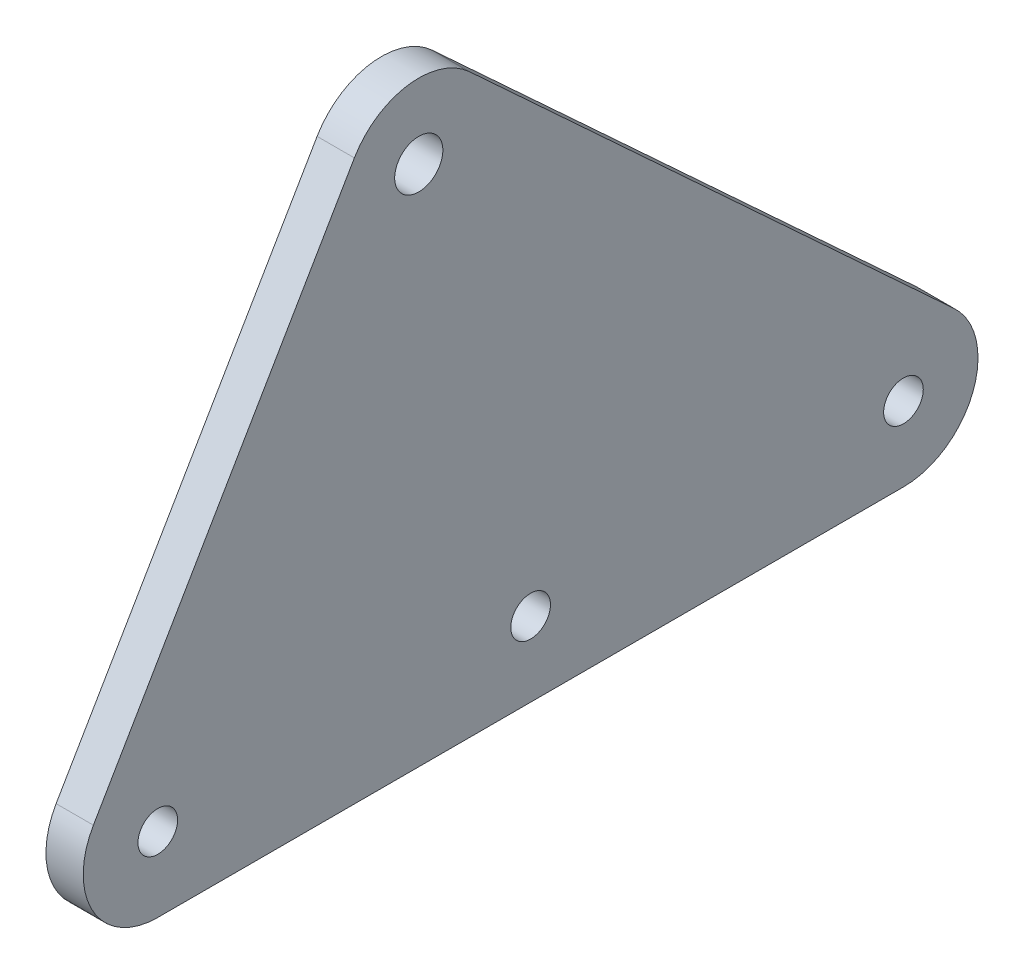
from build123d import *

# Parameters (mm, degrees)
BOSS_EXTRUDE1_DEPTH = 6.35
CUT_EXTRUDE1_REACH  = 132.446
SKETCH2_R           = 3.3782
SKETCH2_R_2         = 4.1021


with BuildPart() as part:
    # Sketch1 → Boss-Extrude1 (new body)
    with BuildSketch(Plane(origin=(0, 0, 0), x_dir=(0, 0, -1), z_dir=(1, 0, 0))):
        with BuildLine():
            Line((-55.419992041, -69.800837976), (-10.969992041, 6.399162024))
            ThreePointArc((-10.969992041, 6.399162024), (-1.880925163, 12.559941104), (8.614157305, 9.332003747))
            Line((8.614157305, 9.332003747), (91.164157305, -66.867996253))
            ThreePointArc((91.164157305, -66.867996253), (94.378069318, -80.824583896), (82.55, -88.9))
            Line((82.55, -88.9), (-44.45, -88.9))
            ThreePointArc((-44.45, -88.9), (-55.462705338, -82.525371226), (-55.419992041, -69.800837976))
        make_face()
    extrude(amount=BOSS_EXTRUDE1_DEPTH)

    # Sketch2 → Cut-Extrude1 (cut, up to next)
    with BuildSketch(Plane(origin=(6.35, 0, 0), x_dir=(0, 0, -1), z_dir=(1, 0, 0)), mode=Mode.PRIVATE) as cut_extrude1_sk1:
        with Locations((-44.45, -76.2)):
            Circle(SKETCH2_R)
    cut_extrude1_tool1 = extrude(cut_extrude1_sk1.sketch, amount=-CUT_EXTRUDE1_REACH, mode=Mode.PRIVATE) & part.part
    # Sketch2 → Cut-Extrude1 (cut, up to next)
    with BuildSketch(Plane(origin=(6.35, 0, 0), x_dir=(0, 0, -1), z_dir=(1, 0, 0)), mode=Mode.PRIVATE) as cut_extrude1_sk2:
        with Locations((19.05, -76.2)):
            Circle(SKETCH2_R)
    cut_extrude1_tool2 = extrude(cut_extrude1_sk2.sketch, amount=-CUT_EXTRUDE1_REACH, mode=Mode.PRIVATE) & part.part
    # Sketch2 → Cut-Extrude1 (cut, up to next)
    with BuildSketch(Plane(origin=(6.35, 0, 0), x_dir=(0, 0, -1), z_dir=(1, 0, 0)), mode=Mode.PRIVATE) as cut_extrude1_sk3:
        with Locations((82.55, -76.2)):
            Circle(SKETCH2_R)
    cut_extrude1_tool3 = extrude(cut_extrude1_sk3.sketch, amount=-CUT_EXTRUDE1_REACH, mode=Mode.PRIVATE) & part.part
    # Sketch2 → Cut-Extrude1 (cut, up to next)
    with BuildSketch(Plane(origin=(6.35, 0, 0), x_dir=(0, 0, -1), z_dir=(1, 0, 0)), mode=Mode.PRIVATE) as cut_extrude1_sk4:
        Circle(SKETCH2_R_2)
    cut_extrude1_tool4 = extrude(cut_extrude1_sk4.sketch, amount=-CUT_EXTRUDE1_REACH, mode=Mode.PRIVATE) & part.part
    add(cut_extrude1_tool1.solids().sort_by_distance((6.35, -76.2, 44.45))[0], mode=Mode.SUBTRACT)
    add(cut_extrude1_tool2.solids().sort_by_distance((6.35, -76.2, -19.05))[0], mode=Mode.SUBTRACT)
    add(cut_extrude1_tool3.solids().sort_by_distance((6.35, -76.2, -82.55))[0], mode=Mode.SUBTRACT)
    add(cut_extrude1_tool4.solids().sort_by_distance((6.35, 0, 0))[0], mode=Mode.SUBTRACT)


solid = part.part
